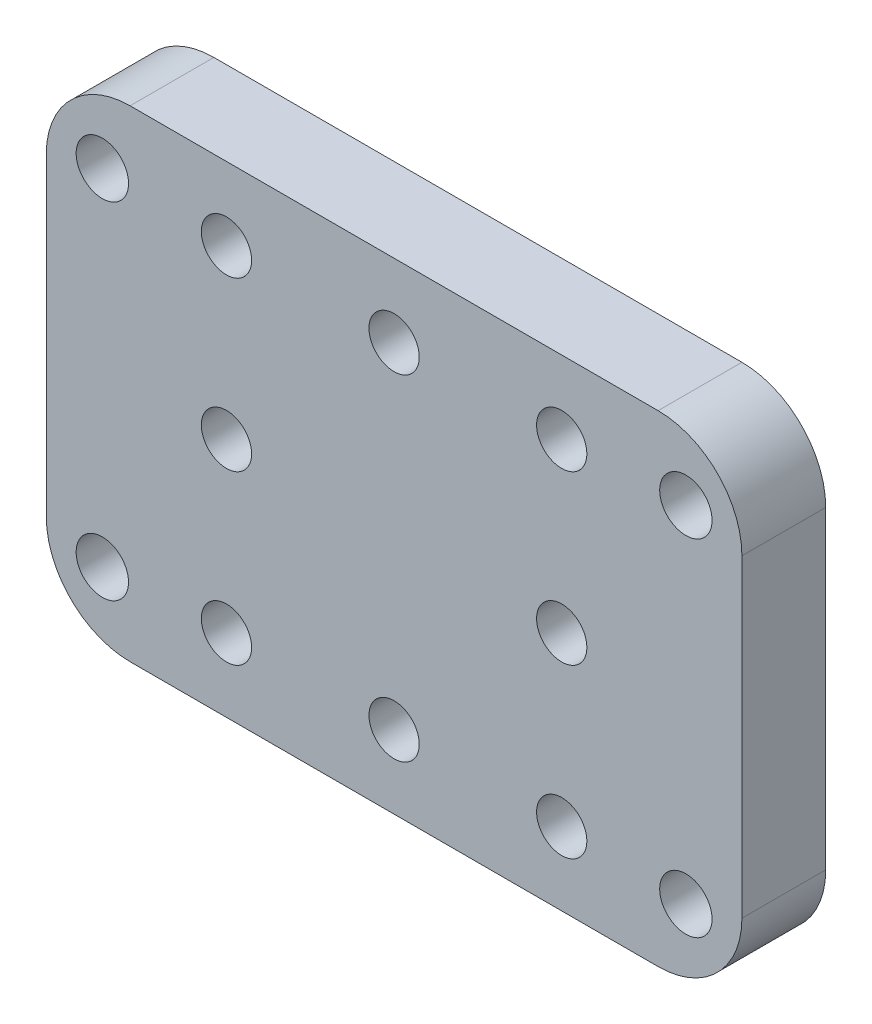
from build123d import *

# Parameters (mm, degrees)
CROQUIS1_W              = 33.201006025
CROQUIS1_H              = 22.978323476
SALIENTE_EXTRUIR1_DEPTH = 4
REDONDEO2_R             = 4
REDONDEO3_R             = 4
CROQUIS4_R              = 1.2
CORTAR_EXTRUIR3_DEPTH   = 41.665750555
CROQUIS3D2_R            = 1.25
CORTAR_EXTRUIR4_DEPTH   = 23
CROQUIS5_R              = 2
CORTAR_EXTRUIR5_DEPTH   = 2


with BuildPart() as part:
    # Croquis1 → Saliente-Extruir1 (new body)
    with BuildSketch(Plane.XY):
        with Locations((16.58985656, 11.664742893)):
            Rectangle(CROQUIS1_W, CROQUIS1_H)
    extrude(amount=SALIENTE_EXTRUIR1_DEPTH)

    # Redondeo2
    redondeo2_edges = [part.edges().sort_by_distance(p)[0] for p in [
        (33.190359572, 0.175581155, 2),
        (33.190359572, 23.153904631, 2),
    ]]
    fillet(redondeo2_edges, radius=REDONDEO2_R)

    # Redondeo3
    redondeo3_edges = [part.edges().sort_by_distance(p)[0] for p in [
        (-0.010646453, 0.175581155, 2),
        (-0.010646453, 23.153904631, 2),
    ]]
    fillet(redondeo3_edges, radius=REDONDEO3_R)

    # Croquis4 → Cortar-Extruir3 (cut, through all)
    with BuildSketch(Plane.XY.offset(4)):
        with Locations((8.589856559, 19.664742893)):
            Circle(CROQUIS4_R)
        with Locations((16.589856559, 19.664742893)):
            Circle(CROQUIS4_R)
        with Locations((8.589856559, 11.664742893)):
            Circle(CROQUIS4_R)
        with Locations((24.589856559, 19.664742893)):
            Circle(CROQUIS4_R)
        with Locations((8.589856559, 3.664742893)):
            Circle(CROQUIS4_R)
        with Locations((24.589856559, 11.664742893)):
            Circle(CROQUIS4_R)
        with Locations((16.589856559, 3.664742893)):
            Circle(CROQUIS4_R)
        with Locations((24.589856559, 3.664742893)):
            Circle(CROQUIS4_R)
    extrude(amount=-CORTAR_EXTRUIR3_DEPTH, mode=Mode.SUBTRACT)

    # Croquis3D2 → Cortar-Extruir4 (cut)
    with BuildSketch(Plane(origin=(2.664856559, 3.424742893, 13), x_dir=(1, 0, 0), z_dir=(0, 0, 1))):
        Circle(CROQUIS3D2_R)
        with Locations((0, 16.48)):
            Circle(CROQUIS3D2_R)
        with Locations((27.85, 0)):
            Circle(CROQUIS3D2_R)
        with Locations((27.85, 16.48)):
            Circle(CROQUIS3D2_R)
    extrude(amount=-CORTAR_EXTRUIR4_DEPTH, mode=Mode.SUBTRACT)

    # Croquis5 → Cortar-Extruir5 (cut)
    with BuildSketch(Plane(origin=(0, 0, 0), x_dir=(-1, 0, 0), z_dir=(0, 0, -1))):
        with Locations((-30.514856559, 19.904742893)):
            Circle(CROQUIS5_R)
        with Locations((-2.664856559, 19.904742893)):
            Circle(CROQUIS5_R)
        with Locations((-30.514856559, 3.424742893)):
            Circle(CROQUIS5_R)
        with Locations((-2.664856559, 3.424742893)):
            Circle(CROQUIS5_R)
    extrude(amount=-CORTAR_EXTRUIR5_DEPTH, mode=Mode.SUBTRACT)


solid = part.part
